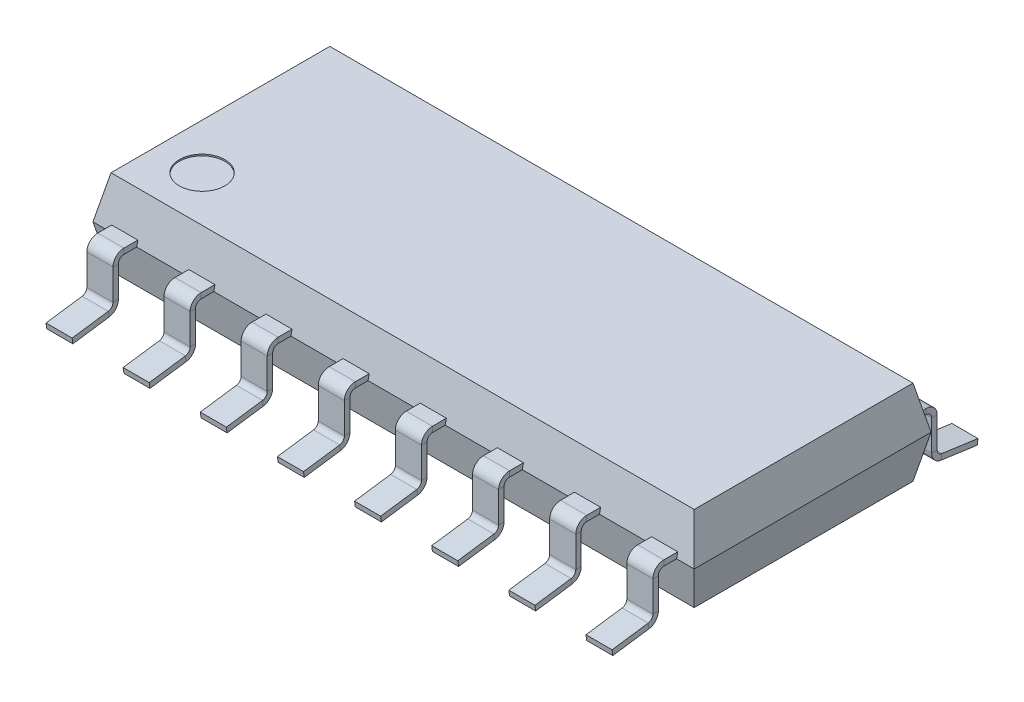
from build123d import *

# Parameters (mm, degrees)
SKETCH1_W                     = 9.9
SKETCH1_H                     = 3.9
BOSS_EXTRUDE1_DEPTH           = 0.7
BOSS_EXTRUDE1_TAPER           = 12
BOSS_EXTRUDE1_OTHER_WAY_DEPTH = 0.7
BOSS_EXTRUDE1_OTHER_WAY_TAPER = 12
BASE_FLANGE1_DEPTH            = 0.215
BASE_FLANGE1_DEPTH_BACK       = 0.215
LPATTERN1_COUNT               = 5
LPATTERN1_PITCH               = 1.27
LPATTERN1_2_COUNT             = 4
LPATTERN1_2_PITCH             = 1.27
BASE_FLANGE2_DEPTH            = 0.215
BASE_FLANGE2_DEPTH_BACK       = 0.215
LPATTERN2_COUNT               = 4
LPATTERN2_PITCH               = 1.27
LPATTERN2_2_COUNT             = 5
LPATTERN2_2_PITCH             = 1.27
SKETCH87_R                    = 0.375
CUT_EXTRUDE1_DEPTH            = 0.025


# Sheet-metal steps are written as plain solids
with BuildPart() as part:
    # Sketch1 → Boss-Extrude1 (new body)
    with BuildSketch(Plane(origin=(0, 0, 0), x_dir=(1, 0, 0), z_dir=(0, 1, 0))):
        Rectangle(SKETCH1_W, SKETCH1_H)
    extrude(amount=BOSS_EXTRUDE1_DEPTH, taper=BOSS_EXTRUDE1_TAPER)

    # Sketch1 → Boss-Extrude1 other way (add)
    with BuildSketch(Plane(origin=(0, 0, 0), x_dir=(1, 0, 0), z_dir=(0, 1, 0))):
        Rectangle(SKETCH1_W, SKETCH1_H)
    extrude(amount=-BOSS_EXTRUDE1_OTHER_WAY_DEPTH, taper=BOSS_EXTRUDE1_OTHER_WAY_TAPER)

    # Sketch87 → Cut-Extrude1 (cut)
    with BuildSketch(Plane(origin=(0, 0.7, 0), x_dir=(1, 0, 0), z_dir=(0, 1, 0))):
        with Locations(Location((-4.051210407, -1.051210407, 0), (0, 0, 270))):
            Circle(SKETCH87_R)
    extrude(amount=-CUT_EXTRUDE1_DEPTH, mode=Mode.SUBTRACT)


with BuildPart() as body_2:
    # Sketch2 → Base-Flange1 (new, two sides: drawn at the far end of the back side and taken through both)
    with BuildSketch(Plane(origin=(-0.635, 0, 0), x_dir=(0, 0, -1), z_dir=(1, 0, 0)).offset(-BASE_FLANGE1_DEPTH_BACK)):
        with BuildLine():
            Line((-1.85, 0), (-1.95, 0))
            Line((-1.95, 0), (-2.16, 0))
            ThreePointArc((-2.16, 0), (-2.22363961, -0.02636039), (-2.25, -0.09))
            Line((-2.25, -0.09), (-2.25, -0.593528387))
            ThreePointArc((-2.25, -0.593528387), (-2.294152276, -0.711619012), (-2.404948842, -0.77177664))
            Line((-2.404948842, -0.77177664), (-3, -0.855405626))
            Line((-3, -0.855405626), (-3.012525579, -0.7662815))
            Line((-3.012525579, -0.7662815), (-2.417474421, -0.682652513))
            ThreePointArc((-2.417474421, -0.682652513), (-2.362076138, -0.6525737), (-2.34, -0.593528387))
            Line((-2.34, -0.593528387), (-2.34, -0.09))
            ThreePointArc((-2.34, -0.09), (-2.287279221, 0.037279221), (-2.16, 0.09))
            Line((-2.16, 0.09), (-1.95, 0.09))
            Line((-1.95, 0.09), (-1.85, 0.09))
            Line((-1.85, 0.09), (-1.85, 0))
        make_face()
    extrude(amount=BASE_FLANGE1_DEPTH + BASE_FLANGE1_DEPTH_BACK)


with BuildPart() as lpattern1_1:
    # LPattern1: pattern copy
    add(body_2.part.moved(Location(Vector(1, 0, 0) * (1 * LPATTERN1_PITCH))))


with BuildPart() as lpattern1_2:
    # LPattern1: pattern copy
    add(body_2.part.moved(Location(Vector(1, 0, 0) * (2 * LPATTERN1_PITCH))))


with BuildPart() as lpattern1_3:
    # LPattern1: pattern copy
    add(body_2.part.moved(Location(Vector(1, 0, 0) * (3 * LPATTERN1_PITCH))))


with BuildPart() as lpattern1_4:
    # LPattern1: pattern copy
    add(body_2.part.moved(Location(Vector(1, 0, 0) * (4 * LPATTERN1_PITCH))))


with BuildPart() as lpattern1_2_1:
    # LPattern1 2: pattern copy
    add(body_2.part.moved(Location(Vector(-1, 0, 0) * (1 * LPATTERN1_2_PITCH))))


with BuildPart() as lpattern1_2_2:
    # LPattern1 2: pattern copy
    add(body_2.part.moved(Location(Vector(-1, 0, 0) * (2 * LPATTERN1_2_PITCH))))


with BuildPart() as lpattern1_2_3:
    # LPattern1 2: pattern copy
    add(body_2.part.moved(Location(Vector(-1, 0, 0) * (3 * LPATTERN1_2_PITCH))))


with BuildPart() as body_10:
    # Sketch58 → Base-Flange2 (new, two sides: drawn at the far end of the back side and taken through both)
    with BuildSketch(Plane(origin=(-0.635, 0, 0), x_dir=(0, 0, -1), z_dir=(1, 0, 0)).offset(-BASE_FLANGE2_DEPTH_BACK)):
        with BuildLine():
            Line((1.85, 0), (1.95, 0))
            Line((1.95, 0), (2.16, 0))
            ThreePointArc((2.16, 0), (2.22363961, -0.02636039), (2.25, -0.09))
            Line((2.25, -0.09), (2.25, -0.593528387))
            ThreePointArc((2.25, -0.593528387), (2.294152276, -0.711619012), (2.404948842, -0.77177664))
            Line((2.404948842, -0.77177664), (3, -0.855405626))
            Line((3, -0.855405626), (3.012525579, -0.7662815))
            Line((3.012525579, -0.7662815), (2.417474421, -0.682652513))
            ThreePointArc((2.417474421, -0.682652513), (2.362076138, -0.6525737), (2.34, -0.593528387))
            Line((2.34, -0.593528387), (2.34, -0.09))
            ThreePointArc((2.34, -0.09), (2.287279221, 0.037279221), (2.16, 0.09))
            Line((2.16, 0.09), (1.95, 0.09))
            Line((1.95, 0.09), (1.85, 0.09))
            Line((1.85, 0.09), (1.85, 0))
        make_face()
    extrude(amount=BASE_FLANGE2_DEPTH + BASE_FLANGE2_DEPTH_BACK)


with BuildPart() as lpattern2_1:
    # LPattern2: pattern copy
    add(body_10.part.moved(Location(Vector(-1, 0, 0) * (1 * LPATTERN2_PITCH))))


with BuildPart() as lpattern2_2:
    # LPattern2: pattern copy
    add(body_10.part.moved(Location(Vector(-1, 0, 0) * (2 * LPATTERN2_PITCH))))


with BuildPart() as lpattern2_3:
    # LPattern2: pattern copy
    add(body_10.part.moved(Location(Vector(-1, 0, 0) * (3 * LPATTERN2_PITCH))))


with BuildPart() as lpattern2_2_1:
    # LPattern2 2: pattern copy
    add(body_10.part.moved(Location(Vector(1, 0, 0) * (1 * LPATTERN2_2_PITCH))))


with BuildPart() as lpattern2_2_2:
    # LPattern2 2: pattern copy
    add(body_10.part.moved(Location(Vector(1, 0, 0) * (2 * LPATTERN2_2_PITCH))))


with BuildPart() as lpattern2_2_3:
    # LPattern2 2: pattern copy
    add(body_10.part.moved(Location(Vector(1, 0, 0) * (3 * LPATTERN2_2_PITCH))))


with BuildPart() as lpattern2_2_4:
    # LPattern2 2: pattern copy
    add(body_10.part.moved(Location(Vector(1, 0, 0) * (4 * LPATTERN2_2_PITCH))))


solid = Compound([part.part, body_2.part, lpattern1_1.part, lpattern1_2.part, lpattern1_3.part, lpattern1_4.part, lpattern1_2_1.part, lpattern1_2_2.part, lpattern1_2_3.part, body_10.part, lpattern2_1.part, lpattern2_2.part, lpattern2_3.part, lpattern2_2_1.part, lpattern2_2_2.part, lpattern2_2_3.part, lpattern2_2_4.part])
